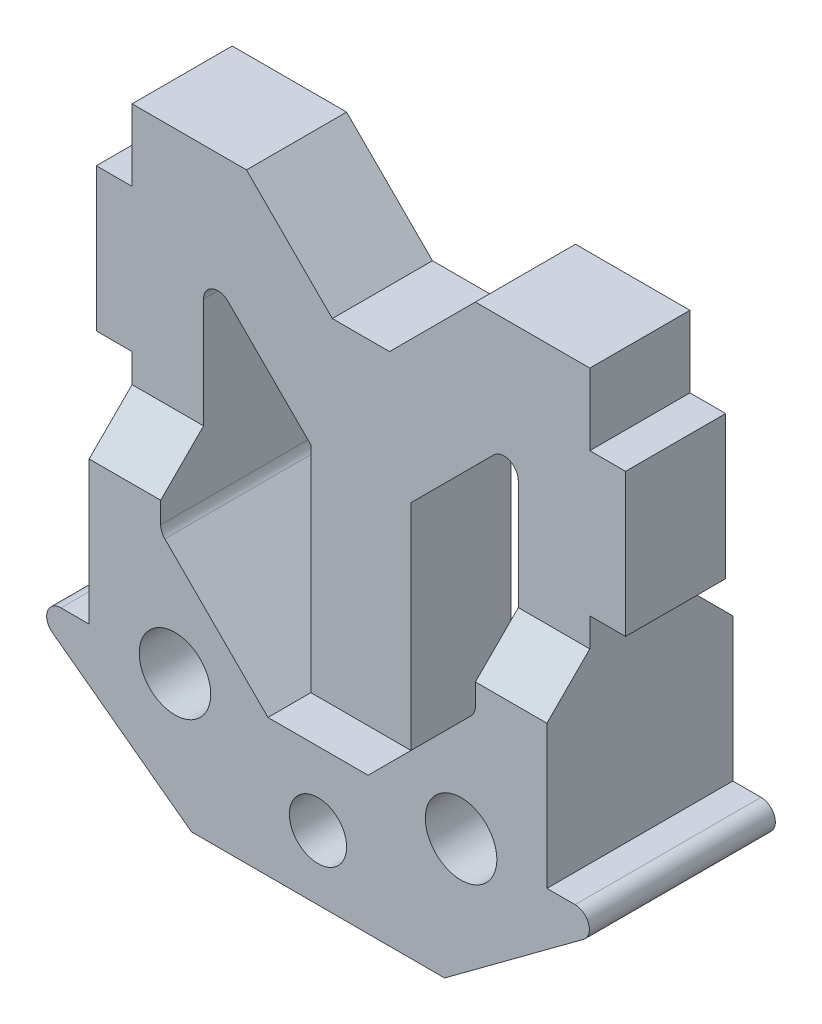
from build123d import *

# Parameters (mm, degrees)
ESQUISSE1_W             = 2.5
ESQUISSE1_H             = 10
BOSS_EXTRU_1_DEPTH      = 7
BOSS_EXTRU_2_DEPTH      = 3
BOSS_EXTRU_2_DEPTH_BACK = 10
ENL_V_MAT_EXTRU_1_REACH = 44.024
ESQUISSE4_4_W           = 7
ESQUISSE4_4_H           = 9.399494937
ENL_V_MAT_EXTRU_4_DEPTH = 3
ENL_V_START             = -13
ESQUISSE4_W             = 7
ESQUISSE4_H             = 9.399494937
ENL_V_MAT_EXTRU_2_DEPTH = 3
CHANFREIN1_SIZE         = 3
CONG_1_R                = 1
ESQUISSE5_R             = 4.8
ENL_V_MAT_EXTRU_5_DEPTH = 1
ESQUISSE6_R             = 2.5
ESQUISSE6_R_2           = 2
ENL_V_MAT_EXTRU_6_DEPTH = 42.047043387
CHANFREIN2_SIZE         = 1


with BuildPart() as part:
    # Esquisse1 → Boss.-Extru.1 (new body)
    with BuildSketch(Plane.XY):
        Polygon((-8, 6), (-16, 6), (-16, 1), (-16, -9), (-16, -24), (-21, -24), (-7.5, -34), (0, -34), (0, 0), (-2, 0), align=None)
        Polygon((2, 0), (0, 0), (0, -34), (7.5, -34), (21, -24), (16, -24), (16, -9), (16, 1), (16, 6), (8, 6), align=None)
        with Locations((17.25, -4)):
            Rectangle(ESQUISSE1_W, ESQUISSE1_H)
        with Locations((-17.25, -4)):
            Rectangle(ESQUISSE1_W, ESQUISSE1_H)
    extrude(amount=BOSS_EXTRU_1_DEPTH)

    # Esquisse2 → Boss.-Extru.2 (add, two sides: drawn at the far end of the back side and taken through both)
    with BuildSketch(Plane.XY.offset(7).offset(-BOSS_EXTRU_2_DEPTH_BACK)):
        Polygon((16, -14), (-16, -14), (-16, -24), (-21, -24), (-7.5, -34), (7.5, -34), (21, -24), (16, -24), align=None)
    extrude(amount=BOSS_EXTRU_2_DEPTH + BOSS_EXTRU_2_DEPTH_BACK)

    # Esquisse3 → Enlèv. mat.-Extru.1 (cut, up to next)
    with BuildSketch(Plane(origin=(0, 0, -3), x_dir=(-1, 0, 0), z_dir=(0, 0, -1)), mode=Mode.PRIVATE) as enl_v_mat_extru_1_sk1:
        Polygon((-11, -0.899494937), (-3.5, -8.399494937), (-3.5, -23.399494937), (-11, -15.899494937), align=None)
    enl_v_mat_extru_1_tool1 = extrude(enl_v_mat_extru_1_sk1.sketch, amount=-ENL_V_MAT_EXTRU_1_REACH, mode=Mode.PRIVATE) & part.part
    # Esquisse3 → Enlèv. mat.-Extru.1 (cut, up to next)
    with BuildSketch(Plane(origin=(0, 0, -3), x_dir=(-1, 0, 0), z_dir=(0, 0, -1)), mode=Mode.PRIVATE) as enl_v_mat_extru_1_sk2:
        Polygon((11, -15.899494937), (11, -0.899494937), (3.5, -8.399494937), (3.5, -23.399494937), align=None)
    enl_v_mat_extru_1_tool2 = extrude(enl_v_mat_extru_1_sk2.sketch, amount=-ENL_V_MAT_EXTRU_1_REACH, mode=Mode.PRIVATE) & part.part
    add(enl_v_mat_extru_1_tool1.solids().sort_by_distance((7.25, -12.149495, -3))[0], mode=Mode.SUBTRACT)
    add(enl_v_mat_extru_1_tool2.solids().sort_by_distance((-7.25, -12.149495, -3))[0], mode=Mode.SUBTRACT)

    # Esquisse4<4> → Enlèv. mat.-Extru.4 (cut)
    with BuildSketch(Plane(origin=(0, 0, -3), x_dir=(-1, 0, 0), z_dir=(0, 0, -1))):
        with Locations((0, -18.699747469)):
            Rectangle(ESQUISSE4_4_W, ESQUISSE4_4_H)
    extrude(amount=-ENL_V_MAT_EXTRU_4_DEPTH, mode=Mode.SUBTRACT)

    # Esquisse4 → Enlèv. mat.-Extru.2 (cut)
    with BuildSketch(Plane(origin=(0, 0, -3), x_dir=(-1, 0, 0), z_dir=(0, 0, -1)).offset(ENL_V_START)):
        with Locations((0, -18.699747469)):
            Rectangle(ESQUISSE4_W, ESQUISSE4_H)
    extrude(amount=ENL_V_MAT_EXTRU_2_DEPTH, mode=Mode.SUBTRACT)

    # Chanfrein1
    chanfrein1_edges = [part.edges().sort_by_distance(p)[0] for p in [
        (-13.5, -14, 0),
        (-13.5, -14, 7),
        (13.5, -14, 0),
        (13.5, -14, 7),
    ]]
    chamfer(chanfrein1_edges, length=CHANFREIN1_SIZE - 0.0001)  # a hair under: the kernel refuses the full size

    # Congé1
    cong_1_edges = [part.edges().sort_by_distance(p)[0] for p in [
        (11, -15.899494937, 3.5),
        (11, -0.899494937, 3.5),
        (-11, -0.899494937, 3.5),
        (-11, -15.899494937, 3.5),
        (-21, -24, 3.5),
        (21, -24, 3.5),
    ]]
    fillet(cong_1_edges, radius=CONG_1_R)

    # Esquisse5 → Enlèv. mat.-Extru.5 (cut)
    with BuildSketch(Plane.XZ.offset(34)):
        with Locations(Location((0, 3.5, 0), (0, 0, 270))):
            Circle(ESQUISSE5_R)
    extrude(amount=-ENL_V_MAT_EXTRU_5_DEPTH, mode=Mode.SUBTRACT)

    # Esquisse6 → Enlèv. mat.-Extru.6 (cut, through all)
    with BuildSketch(Plane.XY.offset(10)):
        with Locations((-10, -24)):
            Circle(ESQUISSE6_R)
        with Locations((0, -28.5)):
            Circle(ESQUISSE6_R_2)
        with Locations(Location((10, -24, 0), (0, 0, 180))):
            Circle(ESQUISSE6_R)
    extrude(amount=-ENL_V_MAT_EXTRU_6_DEPTH, mode=Mode.SUBTRACT)

    # Chanfrein2
    chanfrein2_edges = [part.edges().sort_by_distance(p)[0] for p in [
        (0, -34, -3),
        (0, -34, 10),
    ]]
    chamfer(chanfrein2_edges, length=CHANFREIN2_SIZE)


solid = part.part
